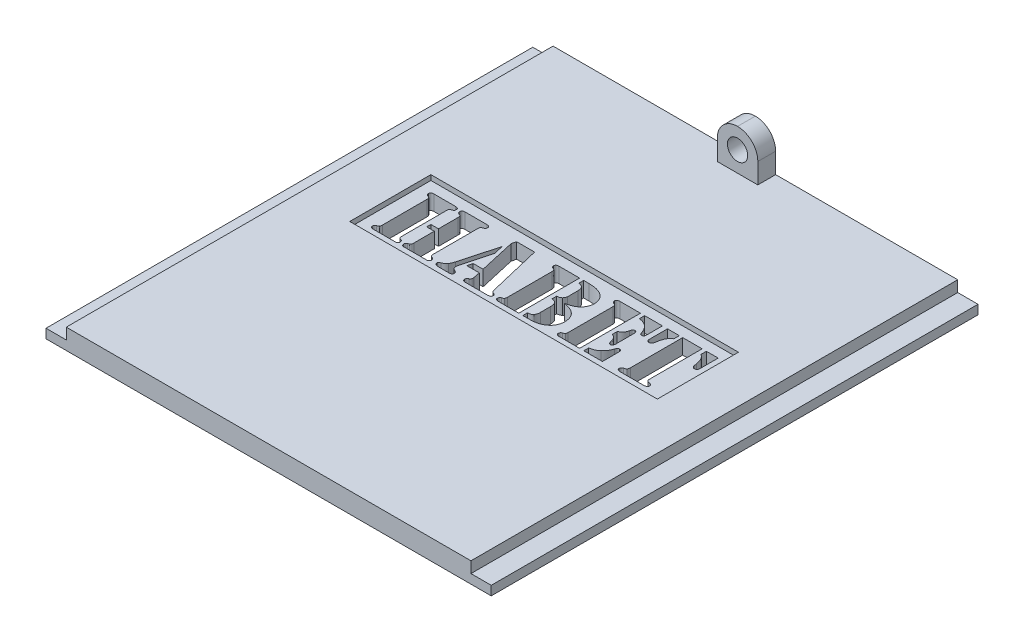
from build123d import *

# Parameters (mm, degrees)
SKETCH1_W           = 139.40028
SKETCH1_H           = 152.4
BOSS_EXTRUDE1_DEPTH = 6.35
SKETCH2_W           = 6.35
SKETCH2_H           = 152.4
CUT_EXTRUDE1_DEPTH  = 3.47472
SKETCH3_W           = 12.7
SKETCH3_H           = 5.586339271
BOSS_EXTRUDE2_DEPTH = 12.7
FILLET1_R           = 6.35
SKETCH4_R           = 3.175
CUT_EXTRUDE2_DEPTH  = 6.35
CUT_EXTRUDE7_DEPTH  = 6.35
SKETCH9_W           = 96.308333333
SKETCH9_H           = 25.4
CUT_EXTRUDE8_DEPTH  = 1.5875


with BuildPart() as part:
    # Sketch1 → Boss-Extrude1 (new body)
    with BuildSketch(Plane(origin=(0, 0, 0), x_dir=(1, 0, 0), z_dir=(0, 1, 0))):
        with Locations((69.70014, 76.2)):
            Rectangle(SKETCH1_W, SKETCH1_H)
    extrude(amount=BOSS_EXTRUDE1_DEPTH)

    # Sketch2 → Cut-Extrude1 (cut)
    with BuildSketch(Plane(origin=(0, 6.35, 0), x_dir=(1, 0, 0), z_dir=(0, 1, 0))):
        with Locations((3.175, 76.2)):
            Rectangle(SKETCH2_W, SKETCH2_H)
        with Locations((136.22528, 76.2)):
            Rectangle(SKETCH2_W, SKETCH2_H)
    extrude(amount=-CUT_EXTRUDE1_DEPTH, mode=Mode.SUBTRACT)

    # Sketch3 → Boss-Extrude2 (add)
    with BuildSketch(Plane(origin=(0, 6.35, 0), x_dir=(1, 0, 0), z_dir=(0, 1, 0))):
        with Locations((69.70014, 149.606830365)):
            Rectangle(SKETCH3_W, SKETCH3_H)
    extrude(amount=BOSS_EXTRUDE2_DEPTH)

    # Fillet1
    fillet1_edges = [part.edges().sort_by_distance(p)[0] for p in [
        (63.35014, 19.05, -149.606830364),
        (76.05014, 19.05, -149.606830364),
    ]]
    fillet(fillet1_edges, radius=FILLET1_R - 0.0001)  # a hair under: the kernel refuses the full size

    # Sketch4 → Cut-Extrude2 (cut)
    with BuildSketch(Plane(origin=(0, 0, -152.4), x_dir=(-1, 0, 0), z_dir=(0, 0, -1))):
        with Locations((-69.70014, 12.7)):
            Circle(SKETCH4_R)
    extrude(amount=-CUT_EXTRUDE2_DEPTH, mode=Mode.SUBTRACT)

    # Sketch7 → Cut-Extrude7 (cut)
    with BuildSketch(Plane(origin=(0, 6.35, 0), x_dir=(1, 0, 0), z_dir=(0, 1, 0))):
        with BuildLine():
            Line((33.98139, 86.51875), (36.36264, 86.51875))
            Line((36.36264, 86.51875), (36.36264, 92.674446615))
            add(Edge.make_bspline(
                [(36.36264, 92.674446615), (36.358254969, 92.79337412), (36.350353986, 93.007658614), (36.288467493, 93.292216987), (36.162305987, 93.506420615), (36.034402539, 93.575942696), (35.974033229, 93.60875651)],
                knots=[0, 0, 0, 0, 1.329658115, 2.395788229, 3.242826058, 4, 4, 4, 4], degree=3))
            Line((35.974033229, 93.60875651), (35.548219427, 93.749316406))
            add(Edge.make_bspline(
                [(35.548219427, 93.749316406), (35.470363369, 93.781123373), (35.321358774, 93.841997045), (35.155464255, 94.021364361), (35.054604435, 94.251060369), (35.044935177, 94.421992946), (35.039723333, 94.514127604)],
                knots=[0, 0, 0, 0, 1.010910902, 1.93472894, 2.886794743, 4, 4, 4, 4], degree=3))
            add(Edge.make_bspline(
                [(35.039723333, 94.514127604), (35.04336266, 94.57213883), (35.050224938, 94.681524219), (35.088866411, 94.836962832), (35.169501188, 94.963061381), (35.267416045, 95.076717923), (35.407472018, 95.152993869), (35.568945655, 95.211291763), (35.760655444, 95.243111258), (35.89676234, 95.247592183), (35.969899115, 95.25)],
                knots=[0, 0, 0, 0, 1.031021055, 1.944083, 2.799047815, 3.663736344, 4.573193868, 5.585804961, 6.702737011, 8, 8, 8, 8], degree=3))
            Line((35.969899115, 95.25), (36.346103542, 95.25))
            Line((36.346103542, 95.25), (42.448056667, 95.25))
            Line((42.448056667, 95.25), (42.824261094, 95.25))
            add(Edge.make_bspline(
                [(42.824261094, 95.25), (42.898791771, 95.247612679), (43.037665311, 95.243164367), (43.233215097, 95.21099988), (43.398335765, 95.154213485), (43.539059768, 95.075320206), (43.64142448, 94.964578719), (43.721620777, 94.836761147), (43.760533683, 94.681583868), (43.767355477, 94.572159502), (43.770973333, 94.514127604)],
                knots=[0, 0, 0, 0, 1.307240179, 2.435789904, 3.46013341, 4.359666904, 5.231495482, 6.077130894, 6.980229479, 8, 8, 8, 8], degree=3))
            add(Edge.make_bspline(
                [(43.770973333, 94.514127604), (43.765427394, 94.424815204), (43.754992327, 94.256767783), (43.654376024, 94.027773862), (43.485227457, 93.846294181), (43.333409962, 93.782563674), (43.25420901, 93.749316406)],
                knots=[0, 0, 0, 0, 1.076488905, 2.025487884, 2.96992611, 4, 4, 4, 4], degree=3))
            add(Edge.make_bspline(
                [(43.25420901, 93.749316406), (43.189425968, 93.725968045), (43.076248368, 93.685177873), (42.927147542, 93.630428772), (42.82429549, 93.589829846), (42.739491177, 93.55875196), (42.66735573, 93.495159348), (42.628064728, 93.433734975), (42.605153021, 93.397916667)],
                knots=[0, 0, 0, 0, 1.636602956, 2.859186374, 3.771360974, 4.270120389, 4.991257728, 6, 6, 6, 6], degree=3))
            add(Edge.make_bspline(
                [(42.605153021, 93.397916667), (42.579472533, 93.354754533), (42.525073829, 93.263324641), (42.485762356, 93.093362429), (42.448793771, 92.896571318), (42.44831364, 92.751884818), (42.448056667, 92.674446615)],
                knots=[0, 0, 0, 0, 0.798774196, 1.692034923, 2.764745377, 4, 4, 4, 4], degree=3))
            Line((42.448056667, 92.674446615), (42.448056667, 78.783821615))
            add(Edge.make_bspline(
                [(42.448056667, 78.783821615), (42.451553734, 78.668832217), (42.457937005, 78.458939622), (42.532250986, 78.178888253), (42.666620642, 77.962588408), (42.800976502, 77.889028473), (42.86560224, 77.853645833)],
                knots=[0, 0, 0, 0, 1.273136709, 2.323883542, 3.193780884, 4, 4, 4, 4], degree=3))
            Line((42.86560224, 77.853645833), (43.266611354, 77.700683594))
            add(Edge.make_bspline(
                [(43.266611354, 77.700683594), (43.342375807, 77.666632393), (43.488753114, 77.600845301), (43.66197076, 77.426532205), (43.752659696, 77.192828477), (43.764635802, 77.024793412), (43.770973333, 76.935872396)],
                knots=[0, 0, 0, 0, 1.008735212, 1.948881546, 2.914586453, 4, 4, 4, 4], degree=3))
            add(Edge.make_bspline(
                [(43.770973333, 76.935872396), (43.767383149, 76.877810317), (43.760613534, 76.768329042), (43.721350783, 76.613533324), (43.642901287, 76.485228447), (43.536300035, 76.379579608), (43.399994513, 76.294578242), (43.232911828, 76.239447166), (43.037758826, 76.206697784), (42.898824431, 76.202339178), (42.824261094, 76.2)],
                knots=[0, 0, 0, 0, 1.020367685, 1.923995112, 2.770125717, 3.62519578, 4.537840383, 5.562783731, 6.691994319, 8, 8, 8, 8], degree=3))
            Line((42.824261094, 76.2), (42.448056667, 76.2))
            Line((42.448056667, 76.2), (36.346103542, 76.2))
            Line((36.346103542, 76.2), (35.940960313, 76.2))
            add(Edge.make_bspline(
                [(35.940960313, 76.2), (35.870520425, 76.202386592), (35.738419135, 76.206862349), (35.552881903, 76.23946176), (35.39342755, 76.294319164), (35.265559402, 76.381088307), (35.162631216, 76.485218543), (35.091463164, 76.615493806), (35.043260004, 76.767155513), (35.040945409, 76.877573254), (35.039723333, 76.935872396)],
                knots=[0, 0, 0, 0, 1.272236934, 2.38592289, 3.394408416, 4.29229074, 5.155307538, 6.014002022, 6.951418688, 8, 8, 8, 8], degree=3))
            add(Edge.make_bspline(
                [(35.039723333, 76.935872396), (35.045537841, 77.025063688), (35.056560809, 77.194149861), (35.154074399, 77.423933889), (35.322342623, 77.603448603), (35.470519219, 77.667235365), (35.548219427, 77.700683594)],
                knots=[0, 0, 0, 0, 1.082756457, 2.052657179, 2.978860728, 4, 4, 4, 4], degree=3))
            Line((35.548219427, 77.700683594), (35.974033229, 77.853645833))
            add(Edge.make_bspline(
                [(35.974033229, 77.853645833), (36.034583478, 77.883362518), (36.164380885, 77.947064133), (36.287999465, 78.162629813), (36.350817717, 78.447572739), (36.358406621, 78.663416038), (36.36264, 78.783821615)],
                knots=[0, 0, 0, 0, 0.740865868, 1.588143233, 2.65457484, 4, 4, 4, 4], degree=3))
            Line((36.36264, 78.783821615), (36.36264, 85.195833333))
            Line((36.36264, 85.195833333), (33.98139, 85.195833333))
            Line((33.98139, 85.195833333), (33.98139, 86.51875))
        make_face()
        with BuildLine():
            Line((32.670875677, 76.2), (26.560654323, 76.2))
            Line((26.560654323, 76.2), (26.19685224, 76.2))
            add(Edge.make_bspline(
                [(26.19685224, 76.2), (26.125040689, 76.202376158), (25.99021491, 76.20683738), (25.799288606, 76.239878552), (25.632545952, 76.295443288), (25.493913669, 76.379738123), (25.3803164, 76.484168123), (25.308200717, 76.615713486), (25.258386897, 76.762863504), (25.25299464, 76.867876553), (25.25014, 76.923470052)],
                knots=[0, 0, 0, 0, 1.275809178, 2.395324508, 3.433364274, 4.378530456, 5.262016052, 6.140052186, 7.015350866, 8, 8, 8, 8], degree=3))
            add(Edge.make_bspline(
                [(25.25014, 76.923470052), (25.255764401, 77.011322637), (25.266343696, 77.176570169), (25.365586585, 77.402040721), (25.53902331, 77.574260052), (25.688152596, 77.638055756), (25.766904323, 77.671744792)],
                knots=[0, 0, 0, 0, 1.074896783, 2.021841926, 2.955380476, 4, 4, 4, 4], degree=3))
            add(Edge.make_bspline(
                [(25.766904323, 77.671744792), (25.831764671, 77.694901049), (25.945077324, 77.73535561), (26.091766098, 77.791349819), (26.194674971, 77.827086055), (26.278053349, 77.859200862), (26.353929924, 77.919864491), (26.393323411, 77.982828852), (26.415960313, 78.019010417)],
                knots=[0, 0, 0, 0, 1.641128884, 2.867093284, 3.73955991, 4.239698614, 4.988468111, 6, 6, 6, 6], degree=3))
            add(Edge.make_bspline(
                [(26.415960313, 78.019010417), (26.441295424, 78.060864408), (26.495870371, 78.151023056), (26.540989365, 78.315666281), (26.570686683, 78.509819854), (26.572223759, 78.649989265), (26.573056667, 78.72594401)],
                knots=[0, 0, 0, 0, 0.795728394, 1.714096871, 2.761318972, 4, 4, 4, 4], degree=3))
            Line((26.573056667, 78.72594401), (26.573056667, 92.674446615))
            add(Edge.make_bspline(
                [(26.573056667, 92.674446615), (26.572046863, 92.751741764), (26.570162914, 92.895948045), (26.542191832, 93.09462471), (26.494872664, 93.262615041), (26.441203426, 93.354635303), (26.415960313, 93.397916667)],
                knots=[0, 0, 0, 0, 1.234380862, 2.302932019, 3.201790819, 4, 4, 4, 4], degree=3))
            add(Edge.make_bspline(
                [(26.415960313, 93.397916667), (26.393311355, 93.434066441), (26.353896887, 93.496975479), (26.278134024, 93.55793895), (26.193961827, 93.589345755), (26.092981985, 93.631533479), (25.944777423, 93.684916037), (25.831655498, 93.725872729), (25.766904323, 93.749316406)],
                knots=[0, 0, 0, 0, 1.009569614, 1.75688657, 2.256055053, 3.138468602, 4.362054748, 6, 6, 6, 6], degree=3))
            add(Edge.make_bspline(
                [(25.766904323, 93.749316406), (25.687703372, 93.782563674), (25.535885877, 93.846294181), (25.366737309, 94.027773862), (25.266121006, 94.256767783), (25.255685939, 94.424815204), (25.25014, 94.514127604)],
                knots=[0, 0, 0, 0, 1.03007389, 1.974512116, 2.923511095, 4, 4, 4, 4], degree=3))
            add(Edge.make_bspline(
                [(25.25014, 94.514127604), (25.253061441, 94.571058029), (25.258584712, 94.678690563), (25.307217029, 94.829116359), (25.380433718, 94.961594207), (25.493782166, 95.066425937), (25.633401371, 95.149446212), (25.798303404, 95.211468089), (25.990370768, 95.242735765), (26.125094854, 95.2474755), (26.19685224, 95.25)],
                knots=[0, 0, 0, 0, 1.002003185, 1.894384998, 2.766311233, 3.643649008, 4.582238159, 5.621343591, 6.733068665, 8, 8, 8, 8], degree=3))
            Line((26.19685224, 95.25), (26.560654323, 95.25))
            Line((26.560654323, 95.25), (32.670875677, 95.25))
            Line((32.670875677, 95.25), (33.03467776, 95.25))
            add(Edge.make_bspline(
                [(33.03467776, 95.25), (33.109208438, 95.247612679), (33.248081978, 95.243164367), (33.443631763, 95.21099988), (33.608752432, 95.154213485), (33.749476435, 95.075320206), (33.851841147, 94.964578719), (33.932037444, 94.836761147), (33.970950349, 94.681583868), (33.977772143, 94.572159502), (33.98139, 94.514127604)],
                knots=[0, 0, 0, 0, 1.307240179, 2.435789904, 3.46013341, 4.359666904, 5.231495482, 6.077130894, 6.980229479, 8, 8, 8, 8], degree=3))
            add(Edge.make_bspline(
                [(33.98139, 94.514127604), (33.976105432, 94.42206441), (33.966301251, 94.251264417), (33.865944671, 94.019796617), (33.695643123, 93.843228467), (33.546317909, 93.781419437), (33.468759792, 93.749316406)],
                knots=[0, 0, 0, 0, 1.109983163, 2.059293279, 2.992015108, 4, 4, 4, 4], degree=3))
            Line((33.468759792, 93.749316406), (33.051214219, 93.60875651))
            add(Edge.make_bspline(
                [(33.051214219, 93.60875651), (32.98888829, 93.5764385), (32.858683699, 93.508923206), (32.738857753, 93.289917427), (32.668583654, 93.008801655), (32.662078061, 92.793657362), (32.658473333, 92.674446615)],
                knots=[0, 0, 0, 0, 0.768469074, 1.605402508, 2.673161374, 4, 4, 4, 4], degree=3))
            Line((32.658473333, 92.674446615), (32.658473333, 78.72594401))
            add(Edge.make_bspline(
                [(32.658473333, 78.72594401), (32.661883817, 78.609413714), (32.668025728, 78.399555311), (32.740580589, 78.124696759), (32.858603203, 77.907979191), (32.988862232, 77.840480592), (33.051214219, 77.808170573)],
                knots=[0, 0, 0, 0, 1.316005662, 2.369983217, 3.219748642, 4, 4, 4, 4], degree=3))
            Line((33.051214219, 77.808170573), (33.468759792, 77.671744792))
            add(Edge.make_bspline(
                [(33.468759792, 77.671744792), (33.546199843, 77.641049819), (33.694905023, 77.582107431), (33.867066383, 77.409191576), (33.964979806, 77.180475024), (33.975695118, 77.012659308), (33.98139, 76.923470052)],
                knots=[0, 0, 0, 0, 1.013906066, 1.946965185, 2.908870689, 4, 4, 4, 4], degree=3))
            add(Edge.make_bspline(
                [(33.98139, 76.923470052), (33.977716568, 76.866780426), (33.970711377, 76.758673959), (33.931592537, 76.60541922), (33.854459795, 76.477255135), (33.746284361, 76.375168893), (33.609219932, 76.29532482), (33.443486072, 76.239144002), (33.248126903, 76.206791266), (33.109224128, 76.202371826), (33.03467776, 76.2)],
                knots=[0, 0, 0, 0, 1.003012501, 1.91273332, 2.764569601, 3.608364563, 4.51449415, 5.546348955, 6.6831741, 8, 8, 8, 8], degree=3))
            Line((33.03467776, 76.2), (32.670875677, 76.2))
        make_face()
        with BuildLine():
            Line((52.097080104, 95.25), (57.719475938, 95.25))
            Line((57.719475938, 95.25), (61.626214219, 78.849967448))
            add(Edge.make_bspline(
                [(61.626214219, 78.849967448), (61.663908229, 78.714167542), (61.735791565, 78.45519403), (61.832431222, 78.204426775), (61.878395208, 78.08515625)],
                knots=[0, 0, 0, 0, 1.048755183, 2, 2, 2, 2], degree=3))
            add(Edge.make_bspline(
                [(61.878395208, 78.08515625), (61.903775603, 78.040721307), (61.956415575, 77.948561425), (62.086098711, 77.836151776), (62.247337704, 77.73267795), (62.373455726, 77.679435031), (62.440634792, 77.651074219)],
                knots=[0, 0, 0, 0, 0.840160251, 1.742526606, 2.797515595, 4, 4, 4, 4], degree=3))
            add(Edge.make_bspline(
                [(62.440634792, 77.651074219), (62.546019514, 77.60421987), (62.72678057, 77.523852987), (62.947620792, 77.365376206), (63.073527844, 77.159540795), (63.081391452, 77.007916743), (63.085556667, 76.927604167)],
                knots=[0, 0, 0, 0, 1.326867952, 2.275909135, 3.086779591, 4, 4, 4, 4], degree=3))
            add(Edge.make_bspline(
                [(63.085556667, 76.927604167), (63.083044393, 76.870610428), (63.078197883, 76.760661926), (63.022192103, 76.608108908), (62.931589388, 76.477852908), (62.803885359, 76.373596881), (62.640694722, 76.295202274), (62.445308952, 76.238324756), (62.214241495, 76.207023002), (62.049365909, 76.202449202), (61.9610775, 76.2)],
                knots=[0, 0, 0, 0, 0.899652897, 1.735550104, 2.535289427, 3.388132219, 4.315971308, 5.386976564, 6.600765056, 8, 8, 8, 8], degree=3))
            Line((61.9610775, 76.2), (54.999228542, 76.2))
            add(Edge.make_bspline(
                [(54.999228542, 76.2), (54.934178971, 76.201768506), (54.808151906, 76.205194811), (54.63154095, 76.248414359), (54.471893417, 76.310201857), (54.336293061, 76.400351231), (54.227086661, 76.513792589), (54.145592604, 76.644076493), (54.099425362, 76.793726157), (54.093028058, 76.898358033), (54.089723333, 76.952408854)],
                knots=[0, 0, 0, 0, 1.175318829, 2.277063206, 3.273429624, 4.263211015, 5.198644873, 6.106027898, 7.021610334, 8, 8, 8, 8], degree=3))
            add(Edge.make_bspline(
                [(54.089723333, 76.952408854), (54.092333304, 77.03589774), (54.096978067, 77.184476414), (54.169258916, 77.358870658), (54.267663195, 77.465599972), (54.375519239, 77.546627241), (54.509765512, 77.642792935), (54.615420346, 77.701802334), (54.67263349, 77.73375651)],
                knots=[0, 0, 0, 0, 1.432553572, 2.549404146, 3.155101411, 3.915709373, 4.871335893, 6, 6, 6, 6], degree=3))
            add(Edge.make_bspline(
                [(54.67263349, 77.73375651), (54.749784625, 77.781089926), (54.888697166, 77.866314921), (55.048779309, 78.038471568), (55.139320671, 78.245156556), (55.145018229, 78.394252163), (55.148056667, 78.473763021)],
                knots=[0, 0, 0, 0, 1.161992046, 2.092195629, 2.982591342, 4, 4, 4, 4], degree=3))
            add(Edge.make_bspline(
                [(55.148056667, 78.473763021), (55.147476783, 78.549752782), (55.146385804, 78.692718112), (55.122186422, 78.833584537), (55.110849635, 78.899576823)],
                knots=[0, 0, 0, 0, 1.063051602, 2, 2, 2, 2], degree=3))
            Line((55.110849635, 78.899576823), (54.705706406, 80.9625))
            Line((54.705706406, 80.9625), (50.815504583, 80.9625))
            Line((50.815504583, 80.9625), (51.19170901, 82.55))
            Line((51.19170901, 82.55), (54.317099635, 82.55))
            Line((54.317099635, 82.55), (51.749814479, 93.8609375))
            Line((51.749814479, 93.8609375), (52.097080104, 95.25))
        make_face()
        with BuildLine():
            Line((51.133831406, 91.653320312), (51.844899115, 88.751171875))
            Line((51.844899115, 88.751171875), (49.434710313, 79.780143229))
            add(Edge.make_bspline(
                [(49.434710313, 79.780143229), (49.404442749, 79.656718777), (49.346438878, 79.420191774), (49.333439419, 79.177065489), (49.327223333, 79.060807292)],
                knots=[0, 0, 0, 0, 1.043639418, 2, 2, 2, 2], degree=3))
            add(Edge.make_bspline(
                [(49.327223333, 79.060807292), (49.334278502, 78.924141807), (49.347750577, 78.663174622), (49.497289144, 78.306918913), (49.732700161, 78.007051937), (49.950233498, 77.87882982), (50.063095729, 77.812304687)],
                knots=[0, 0, 0, 0, 1.065909191, 2.035388236, 2.980705811, 4, 4, 4, 4], degree=3))
            Line((50.063095729, 77.812304687), (50.501311875, 77.5890625))
            add(Edge.make_bspline(
                [(50.501311875, 77.5890625), (50.564634562, 77.551119218), (50.685353588, 77.478783754), (50.822393704, 77.314781266), (50.902845564, 77.114995286), (50.910673713, 76.969696514), (50.914723333, 76.89453125)],
                knots=[0, 0, 0, 0, 1.03129857, 1.96607825, 2.947821365, 4, 4, 4, 4], degree=3))
            add(Edge.make_bspline(
                [(50.914723333, 76.89453125), (50.913414574, 76.840364794), (50.910910151, 76.736712589), (50.862304065, 76.593243141), (50.791211119, 76.470365505), (50.693387766, 76.3651821), (50.560513591, 76.293418377), (50.404283934, 76.239008435), (50.22006117, 76.20690764), (50.088025413, 76.202402343), (50.017620469, 76.2)],
                knots=[0, 0, 0, 0, 1.001089615, 1.915671698, 2.776004461, 3.626767041, 4.544209435, 5.547912865, 6.692482548, 8, 8, 8, 8], degree=3))
            Line((50.017620469, 76.2), (46.474684271, 76.2))
            add(Edge.make_bspline(
                [(46.474684271, 76.2), (46.393165819, 76.201748698), (46.237223015, 76.205093915), (46.017440351, 76.247354884), (45.82223882, 76.312594435), (45.657289001, 76.406213205), (45.52349119, 76.525301254), (45.42643889, 76.666646734), (45.371082155, 76.831477198), (45.362779988, 76.9464905), (45.358473333, 77.006152344)],
                knots=[0, 0, 0, 0, 1.263225168, 2.41651886, 3.457937625, 4.444571192, 5.337806274, 6.215550556, 7.074337118, 8, 8, 8, 8], degree=3))
            add(Edge.make_bspline(
                [(45.358473333, 77.006152344), (45.365632938, 77.072691554), (45.380469635, 77.210579343), (45.51241368, 77.394878213), (45.711854483, 77.554665749), (45.878451373, 77.632794376), (45.970322292, 77.675878906)],
                knots=[0, 0, 0, 0, 0.824400861, 1.708388363, 2.736276122, 4, 4, 4, 4], degree=3))
            add(Edge.make_bspline(
                [(45.970322292, 77.675878906), (46.060215941, 77.715116947), (46.229184636, 77.788870772), (46.460757524, 77.902778389), (46.651523513, 78.015274139), (46.864259539, 78.156330633), (47.100586801, 78.369083883), (47.25646636, 78.570211968), (47.338714219, 78.676334635)],
                knots=[0, 0, 0, 0, 1.026075952, 1.928664772, 2.697596979, 3.341335493, 4.597189607, 6, 6, 6, 6], degree=3))
            add(Edge.make_bspline(
                [(47.338714219, 78.676334635), (47.402883936, 78.778493946), (47.536952591, 78.991933588), (47.702873981, 79.351142535), (47.858697725, 79.753364872), (47.938043795, 80.042488231), (47.979501979, 80.193554687)],
                knots=[0, 0, 0, 0, 0.874304226, 1.826668352, 2.864437965, 4, 4, 4, 4], degree=3))
            Line((47.979501979, 80.193554687), (51.133831406, 91.653320312))
        make_face()
        with BuildLine():
            Line((71.816806667, 95.25), (71.816806667, 76.2))
            Line((71.816806667, 76.2), (65.718987656, 76.2))
            Line((65.718987656, 76.2), (65.355185573, 76.2))
            add(Edge.make_bspline(
                [(65.355185573, 76.2), (65.283374023, 76.202376158), (65.148548243, 76.20683738), (64.95762194, 76.239878552), (64.790879285, 76.295443288), (64.652247002, 76.379738123), (64.538649733, 76.484168123), (64.466534051, 76.615713486), (64.41672023, 76.762863504), (64.411327973, 76.867876553), (64.408473333, 76.923470052)],
                knots=[0, 0, 0, 0, 1.275809178, 2.395324508, 3.433364274, 4.378530456, 5.262016052, 6.140052186, 7.015350866, 8, 8, 8, 8], degree=3))
            add(Edge.make_bspline(
                [(64.408473333, 76.923470052), (64.414097735, 77.011322637), (64.42467703, 77.176570169), (64.523919918, 77.402040721), (64.697356644, 77.574260052), (64.84648593, 77.638055756), (64.925237656, 77.671744792)],
                knots=[0, 0, 0, 0, 1.074896783, 2.021841926, 2.955380476, 4, 4, 4, 4], degree=3))
            add(Edge.make_bspline(
                [(64.925237656, 77.671744792), (64.990098004, 77.694901049), (65.103410658, 77.73535561), (65.250099431, 77.791349819), (65.353008305, 77.827086055), (65.436386683, 77.859200862), (65.512263257, 77.919864491), (65.551656744, 77.982828852), (65.574293646, 78.019010417)],
                knots=[0, 0, 0, 0, 1.641128884, 2.867093284, 3.73955991, 4.239698614, 4.988468111, 6, 6, 6, 6], degree=3))
            add(Edge.make_bspline(
                [(65.574293646, 78.019010417), (65.599628757, 78.060864408), (65.654203704, 78.151023056), (65.699322698, 78.315666281), (65.729020017, 78.509819854), (65.730557092, 78.649989265), (65.73139, 78.72594401)],
                knots=[0, 0, 0, 0, 0.795728394, 1.714096871, 2.761318972, 4, 4, 4, 4], degree=3))
            Line((65.73139, 78.72594401), (65.73139, 92.674446615))
            add(Edge.make_bspline(
                [(65.73139, 92.674446615), (65.730380196, 92.751741764), (65.728496247, 92.895948045), (65.700525166, 93.09462471), (65.653205998, 93.262615041), (65.599536759, 93.354635303), (65.574293646, 93.397916667)],
                knots=[0, 0, 0, 0, 1.234380862, 2.302932019, 3.201790819, 4, 4, 4, 4], degree=3))
            add(Edge.make_bspline(
                [(65.574293646, 93.397916667), (65.551644688, 93.434066441), (65.512230221, 93.496975479), (65.436467358, 93.55793895), (65.35229516, 93.589345755), (65.251315318, 93.631533479), (65.103110757, 93.684916037), (64.989988831, 93.725872729), (64.925237656, 93.749316406)],
                knots=[0, 0, 0, 0, 1.009569614, 1.75688657, 2.256055053, 3.138468602, 4.362054748, 6, 6, 6, 6], degree=3))
            add(Edge.make_bspline(
                [(64.925237656, 93.749316406), (64.846036705, 93.782563674), (64.69421921, 93.846294181), (64.525070643, 94.027773862), (64.424454339, 94.256767783), (64.414019273, 94.424815204), (64.408473333, 94.514127604)],
                knots=[0, 0, 0, 0, 1.03007389, 1.974512116, 2.923511095, 4, 4, 4, 4], degree=3))
            add(Edge.make_bspline(
                [(64.408473333, 94.514127604), (64.411394775, 94.571058029), (64.416918045, 94.678690563), (64.465550362, 94.829116359), (64.538767051, 94.961594207), (64.652115499, 95.066425937), (64.791734704, 95.149446212), (64.956636737, 95.211468089), (65.148704101, 95.242735765), (65.283428187, 95.2474755), (65.355185573, 95.25)],
                knots=[0, 0, 0, 0, 1.002003185, 1.894384998, 2.766311233, 3.643649008, 4.582238159, 5.621343591, 6.733068665, 8, 8, 8, 8], degree=3))
            Line((65.355185573, 95.25), (65.718987656, 95.25))
            Line((65.718987656, 95.25), (71.816806667, 95.25))
        make_face()
        with BuildLine():
            add(Edge.make_bspline(
                [(76.281650417, 86.014388021), (76.478840916, 85.973691726), (76.849208839, 85.897254968), (77.368896462, 85.779986424), (77.813759769, 85.655927045), (78.304961766, 85.498926129), (78.849044115, 85.284018209), (79.234934634, 85.047078267), (79.4235775, 84.93125)],
                knots=[0, 0, 0, 0, 1.083455462, 2.034972021, 2.866135129, 3.567292239, 4.810769005, 6, 6, 6, 6], degree=3))
            add(Edge.make_bspline(
                [(79.4235775, 84.93125), (79.572639243, 84.827566522), (79.867499636, 84.622469287), (80.255212908, 84.249710742), (80.585392286, 83.827269243), (80.855667388, 83.357932162), (81.078101722, 82.854721736), (81.226915086, 82.316775349), (81.328808281, 81.753222551), (81.337410142, 81.366741365), (81.341806667, 81.169205729)],
                knots=[0, 0, 0, 0, 0.986962337, 1.952319205, 2.913940247, 3.895330921, 4.892864158, 5.89929397, 6.926301415, 8, 8, 8, 8], degree=3))
            add(Edge.make_bspline(
                [(81.341806667, 81.169205729), (81.335874739, 80.976013916), (81.324341144, 80.600386192), (81.245419652, 80.052355628), (81.110317481, 79.536610943), (80.91286287, 79.055553817), (80.669584652, 78.602629484), (80.362028387, 78.188372275), (80.008538741, 77.799140165), (79.732698478, 77.577318637), (79.593076198, 77.465039062)],
                knots=[0, 0, 0, 0, 1.089371359, 2.118092263, 3.115302193, 4.087984299, 5.044386056, 6.006580044, 6.990989071, 8, 8, 8, 8], degree=3))
            add(Edge.make_bspline(
                [(79.593076198, 77.465039062), (79.441047279, 77.354003712), (79.138956806, 77.133369887), (78.645663877, 76.865959611), (78.132108768, 76.646282421), (77.585889358, 76.471531415), (76.985383601, 76.350047773), (76.31295452, 76.259821661), (75.556250222, 76.207495878), (75.023584027, 76.202581604), (74.743759792, 76.2)],
                knots=[0, 0, 0, 0, 0.883012022, 1.754597232, 2.627046443, 3.502775865, 4.441750639, 5.499460937, 6.686397901, 8, 8, 8, 8], degree=3))
            Line((74.743759792, 76.2), (73.081845729, 76.2))
            Line((73.081845729, 76.2), (73.081845729, 77.667610677))
            add(Edge.make_bspline(
                [(73.081845729, 77.667610677), (73.170215368, 77.674481121), (73.337916393, 77.687519315), (73.571699745, 77.727195563), (73.777443806, 77.765382097), (74.011722197, 77.837195971), (74.279274479, 77.974402899), (74.447234826, 78.140818883), (74.532919948, 78.225716146)],
                knots=[0, 0, 0, 0, 0.997306068, 1.892609856, 2.668508782, 3.350634199, 4.648423657, 6, 6, 6, 6], degree=3))
            add(Edge.make_bspline(
                [(74.532919948, 78.225716146), (74.605854051, 78.320517532), (74.759336565, 78.520017552), (74.889075163, 78.901386305), (74.979411386, 79.341630385), (74.987486486, 79.659625259), (74.991806667, 79.829752604)],
                knots=[0, 0, 0, 0, 0.837912566, 1.76330307, 2.803366532, 4, 4, 4, 4], degree=3))
            Line((74.991806667, 79.829752604), (74.991806667, 82.963411458))
            add(Edge.make_bspline(
                [(74.991806667, 82.963411458), (74.989920245, 83.072301518), (74.986334776, 83.279265741), (74.968068927, 83.56944867), (74.931294449, 83.822832007), (74.861155711, 84.107472648), (74.722093396, 84.438105106), (74.534248838, 84.646514429), (74.437835313, 84.753483073)],
                knots=[0, 0, 0, 0, 1.01571249, 1.930535679, 2.71034331, 3.399269007, 4.665142888, 6, 6, 6, 6], degree=3))
            add(Edge.make_bspline(
                [(74.437835313, 84.753483073), (74.359907295, 84.829609551), (74.208827981, 84.977196214), (73.915700236, 85.127830957), (73.55914543, 85.234768064), (73.292193952, 85.273137306), (73.139723333, 85.295052083)],
                knots=[0, 0, 0, 0, 0.904188909, 1.752954129, 2.716588957, 4, 4, 4, 4], degree=3))
            Line((73.139723333, 85.295052083), (73.139723333, 86.737858073))
            add(Edge.make_bspline(
                [(73.139723333, 86.737858073), (73.291706292, 86.752308872), (73.559500905, 86.77777124), (73.922828212, 86.857187916), (74.21628901, 86.997650878), (74.374213644, 87.129713499), (74.454371771, 87.196744792)],
                knots=[0, 0, 0, 0, 1.287514427, 2.268605844, 3.12119275, 4, 4, 4, 4], degree=3))
            add(Edge.make_bspline(
                [(74.454371771, 87.196744792), (74.52526596, 87.274237889), (74.673522786, 87.436294618), (74.832087179, 87.731936014), (74.956331797, 88.036774983), (74.980631355, 88.248607402), (74.991806667, 88.346028646)],
                knots=[0, 0, 0, 0, 0.970759611, 2.030092153, 3.0940439, 4, 4, 4, 4], degree=3))
            Line((74.991806667, 88.346028646), (74.991806667, 89.110839844))
            Line((74.991806667, 89.110839844), (74.991806667, 91.595442708))
            add(Edge.make_bspline(
                [(74.991806667, 91.595442708), (74.985026886, 91.724273986), (74.971006393, 91.99069529), (74.868524816, 92.37648405), (74.7519606, 92.740008769), (74.61828646, 92.942413827), (74.557724635, 93.034114583)],
                knots=[0, 0, 0, 0, 1.013786551, 2.096496594, 3.137607017, 4, 4, 4, 4], degree=3))
            add(Edge.make_bspline(
                [(74.557724635, 93.034114583), (74.468083274, 93.130992506), (74.295328802, 93.31769309), (74.022476146, 93.487889106), (73.782512852, 93.581789381), (73.573974052, 93.637155092), (73.338696589, 93.689316001), (73.170319818, 93.706968127), (73.081845729, 93.71624349)],
                knots=[0, 0, 0, 0, 1.414668104, 2.726311148, 3.411527514, 4.180983567, 5.044192262, 6, 6, 6, 6], degree=3))
            Line((73.081845729, 93.71624349), (73.081845729, 95.25))
            Line((73.081845729, 95.25), (74.685882188, 95.25))
            add(Edge.make_bspline(
                [(74.685882188, 95.25), (74.942332652, 95.246314056), (75.439491228, 95.239168432), (76.161710672, 95.176113185), (76.83613003, 95.074792576), (77.464078067, 94.930789095), (78.044483574, 94.744140427), (78.582028472, 94.522092075), (79.073710797, 94.255746964), (79.366629533, 94.038058728), (79.510393906, 93.931217448)],
                knots=[0, 0, 0, 0, 1.208139577, 2.342116839, 3.412856412, 4.419296771, 5.374125253, 6.282151548, 7.156880815, 8, 8, 8, 8], degree=3))
            add(Edge.make_bspline(
                [(79.510393906, 93.931217448), (79.63310187, 93.828067387), (79.874746233, 93.624937695), (80.186427223, 93.270424721), (80.45802493, 92.889424605), (80.680115548, 92.474429803), (80.857130541, 92.037771895), (80.98864178, 91.58113807), (81.062715908, 91.105934653), (81.0723635, 90.782644397), (81.077223333, 90.619791667)],
                knots=[0, 0, 0, 0, 1.013187354, 1.995233284, 2.977588935, 3.968692565, 4.966259194, 5.954519567, 6.969619199, 8, 8, 8, 8], degree=3))
            add(Edge.make_bspline(
                [(81.077223333, 90.619791667), (81.072922625, 90.458214379), (81.064379258, 90.137240657), (80.981375582, 89.663457727), (80.854381557, 89.202917774), (80.675687799, 88.76122426), (80.455824124, 88.344441626), (80.186367119, 87.965126187), (79.881692112, 87.617318704), (79.645448389, 87.41983916), (79.526930365, 87.320768229)],
                knots=[0, 0, 0, 0, 1.027420393, 2.040973403, 3.051676841, 4.062988861, 5.067394782, 6.043057479, 7.018247088, 8, 8, 8, 8], degree=3))
            add(Edge.make_bspline(
                [(79.526930365, 87.320768229), (79.337016939, 87.177384044), (78.949898476, 86.885110525), (78.38229446, 86.621071447), (77.868111414, 86.438067079), (77.404893557, 86.293684924), (76.868097978, 86.150437642), (76.484507531, 86.061448723), (76.281650417, 86.014388021)],
                knots=[0, 0, 0, 0, 1.210113677, 2.466688938, 3.168799978, 3.992996522, 4.938620763, 6, 6, 6, 6], degree=3))
        make_face()
        with BuildLine():
            Line((90.866806667, 95.25), (90.866806667, 76.2))
            Line((90.866806667, 76.2), (84.768987656, 76.2))
            Line((84.768987656, 76.2), (84.405185573, 76.2))
            add(Edge.make_bspline(
                [(84.405185573, 76.2), (84.333374023, 76.202376158), (84.198548243, 76.20683738), (84.00762194, 76.239878552), (83.840879285, 76.295443288), (83.702247002, 76.379738123), (83.588649733, 76.484168123), (83.516534051, 76.615713486), (83.46672023, 76.762863504), (83.461327973, 76.867876553), (83.458473333, 76.923470052)],
                knots=[0, 0, 0, 0, 1.275809178, 2.395324508, 3.433364274, 4.378530456, 5.262016052, 6.140052186, 7.015350866, 8, 8, 8, 8], degree=3))
            add(Edge.make_bspline(
                [(83.458473333, 76.923470052), (83.464097735, 77.011322637), (83.47467703, 77.176570169), (83.573919918, 77.402040721), (83.747356644, 77.574260052), (83.89648593, 77.638055756), (83.975237656, 77.671744792)],
                knots=[0, 0, 0, 0, 1.074896783, 2.021841926, 2.955380476, 4, 4, 4, 4], degree=3))
            add(Edge.make_bspline(
                [(83.975237656, 77.671744792), (84.040098004, 77.694901049), (84.153410658, 77.73535561), (84.300099431, 77.791349819), (84.403008305, 77.827086055), (84.486386683, 77.859200862), (84.562263257, 77.919864491), (84.601656744, 77.982828852), (84.624293646, 78.019010417)],
                knots=[0, 0, 0, 0, 1.641128884, 2.867093284, 3.73955991, 4.239698614, 4.988468111, 6, 6, 6, 6], degree=3))
            add(Edge.make_bspline(
                [(84.624293646, 78.019010417), (84.649628757, 78.060864408), (84.704203704, 78.151023056), (84.749322698, 78.315666281), (84.779020017, 78.509819854), (84.780557092, 78.649989265), (84.78139, 78.72594401)],
                knots=[0, 0, 0, 0, 0.795728394, 1.714096871, 2.761318972, 4, 4, 4, 4], degree=3))
            Line((84.78139, 78.72594401), (84.78139, 92.674446615))
            add(Edge.make_bspline(
                [(84.78139, 92.674446615), (84.780380196, 92.751741764), (84.778496247, 92.895948045), (84.750525166, 93.09462471), (84.703205998, 93.262615041), (84.649536759, 93.354635303), (84.624293646, 93.397916667)],
                knots=[0, 0, 0, 0, 1.234380862, 2.302932019, 3.201790819, 4, 4, 4, 4], degree=3))
            add(Edge.make_bspline(
                [(84.624293646, 93.397916667), (84.601644688, 93.434066441), (84.562230221, 93.496975479), (84.486467358, 93.55793895), (84.40229516, 93.589345755), (84.301315318, 93.631533479), (84.153110757, 93.684916037), (84.039988831, 93.725872729), (83.975237656, 93.749316406)],
                knots=[0, 0, 0, 0, 1.009569614, 1.75688657, 2.256055053, 3.138468602, 4.362054748, 6, 6, 6, 6], degree=3))
            add(Edge.make_bspline(
                [(83.975237656, 93.749316406), (83.896036705, 93.782563674), (83.74421921, 93.846294181), (83.575070643, 94.027773862), (83.474454339, 94.256767783), (83.464019273, 94.424815204), (83.458473333, 94.514127604)],
                knots=[0, 0, 0, 0, 1.03007389, 1.974512116, 2.923511095, 4, 4, 4, 4], degree=3))
            add(Edge.make_bspline(
                [(83.458473333, 94.514127604), (83.461394775, 94.571058029), (83.466918045, 94.678690563), (83.515550362, 94.829116359), (83.588767051, 94.961594207), (83.702115499, 95.066425937), (83.841734704, 95.149446212), (84.006636737, 95.211468089), (84.198704101, 95.242735765), (84.333428187, 95.2474755), (84.405185573, 95.25)],
                knots=[0, 0, 0, 0, 1.002003185, 1.894384998, 2.766311233, 3.643649008, 4.582238159, 5.621343591, 6.733068665, 8, 8, 8, 8], degree=3))
            Line((84.405185573, 95.25), (84.768987656, 95.25))
            Line((84.768987656, 95.25), (90.866806667, 95.25))
        make_face()
        with BuildLine():
            Line((92.189723333, 95.25), (97.745973333, 95.25))
            Line((97.745973333, 95.25), (97.745973333, 90.23531901))
            add(Edge.make_bspline(
                [(97.745973333, 90.23531901), (97.745701843, 90.168906164), (97.745199829, 90.046102181), (97.708664377, 89.87730554), (97.663331491, 89.732677828), (97.586737068, 89.617606835), (97.486951467, 89.529868618), (97.362955485, 89.473926561), (97.217861162, 89.434125699), (97.112407772, 89.430903301), (97.055576198, 89.429166667)],
                knots=[0, 0, 0, 0, 1.297100046, 2.398467488, 3.37194797, 4.248080405, 5.071011418, 5.940462097, 6.890061477, 8, 8, 8, 8], degree=3))
            add(Edge.make_bspline(
                [(97.055576198, 89.429166667), (96.968415897, 89.4345285), (96.813738727, 89.444043764), (96.627896524, 89.521378384), (96.541062394, 89.641895965), (96.473108477, 89.75571071), (96.409314475, 89.903432199), (96.372510317, 90.014523679), (96.352776719, 90.074088542)],
                knots=[0, 0, 0, 0, 1.496408907, 2.655570162, 3.259085196, 3.998612629, 4.926899124, 6, 6, 6, 6], degree=3))
            add(Edge.make_bspline(
                [(96.352776719, 90.074088542), (96.261154034, 90.332958843), (96.085338735, 90.829706558), (95.730870599, 91.508944449), (95.312559023, 92.089571565), (94.827760082, 92.576568776), (94.275122559, 92.971204926), (93.645962548, 93.269707628), (92.945779483, 93.488393445), (92.447530812, 93.556816232), (92.189723333, 93.592220052)],
                knots=[0, 0, 0, 0, 1.130832012, 2.169960077, 3.145894403, 4.069657363, 4.990096479, 5.930045021, 6.928948727, 8, 8, 8, 8], degree=3))
            Line((92.189723333, 93.592220052), (92.189723333, 95.25))
        make_face()
        with BuildLine():
            Line((92.189723333, 85.042871094), (92.189723333, 86.651041667))
            add(Edge.make_bspline(
                [(92.189723333, 86.651041667), (92.311703643, 86.717207811), (92.54487037, 86.843685135), (92.866584649, 87.045492413), (93.12891154, 87.269516892), (93.353228309, 87.499037624), (93.530134581, 87.763287135), (93.683538439, 88.056237572), (93.807131836, 88.390271784), (93.866369857, 88.627866941), (93.897112656, 88.751171875)],
                knots=[0, 0, 0, 0, 1.180986571, 2.257469038, 3.222785507, 4.110265038, 4.978639913, 5.917385587, 6.919184056, 8, 8, 8, 8], degree=3))
            add(Edge.make_bspline(
                [(93.897112656, 88.751171875), (93.914812843, 88.834273883), (93.94732151, 88.986901402), (94.014791743, 89.192798251), (94.085200824, 89.359023459), (94.171513915, 89.487976736), (94.274279381, 89.581569131), (94.392117343, 89.650145913), (94.530185053, 89.687596155), (94.62725112, 89.691624673), (94.678460313, 89.69375)],
                knots=[0, 0, 0, 0, 1.505392146, 2.764846178, 3.836585285, 4.697326174, 5.492824879, 6.280783141, 7.092991927, 8, 8, 8, 8], degree=3))
            add(Edge.make_bspline(
                [(94.678460313, 89.69375), (94.745415609, 89.691112545), (94.872670747, 89.686099801), (95.044257569, 89.612098577), (95.182367696, 89.493624), (95.239696784, 89.388819479), (95.269638698, 89.334082031)],
                knots=[0, 0, 0, 0, 1.085852217, 2.06376913, 2.988742716, 4, 4, 4, 4], degree=3))
            add(Edge.make_bspline(
                [(95.269638698, 89.334082031), (95.284838784, 89.293100452), (95.321454274, 89.194379914), (95.342449728, 89.009172338), (95.366299888, 88.768366737), (95.365286913, 88.587317413), (95.364723333, 88.486588542)],
                knots=[0, 0, 0, 0, 0.609895254, 1.469176849, 2.591947466, 4, 4, 4, 4], degree=3))
            Line((95.364723333, 88.486588542), (95.364723333, 83.19905599))
            add(Edge.make_bspline(
                [(95.364723333, 83.19905599), (95.363267061, 83.097056545), (95.360585416, 82.909230207), (95.338708115, 82.651207455), (95.294948993, 82.444034415), (95.234980289, 82.280438533), (95.143449485, 82.16138413), (95.023964683, 82.078306788), (94.875092808, 82.028475869), (94.76568713, 82.023489773), (94.707399115, 82.020833333)],
                knots=[0, 0, 0, 0, 1.58411055, 2.917051989, 4.012593196, 4.866950163, 5.598911493, 6.305405458, 7.097171608, 8, 8, 8, 8], degree=3))
            add(Edge.make_bspline(
                [(94.707399115, 82.020833333), (94.612731806, 82.029032426), (94.432036193, 82.044682392), (94.235816106, 82.179738565), (94.12958357, 82.336041811), (94.056784302, 82.485734466), (93.989301085, 82.666854755), (93.956282597, 82.800368386), (93.938453802, 82.872460937)],
                knots=[0, 0, 0, 0, 1.342036637, 2.56160375, 3.240040044, 4.033620071, 4.938225671, 6, 6, 6, 6], degree=3))
            add(Edge.make_bspline(
                [(93.938453802, 82.872460937), (93.900395712, 83.025061382), (93.827684337, 83.316610118), (93.67262018, 83.716777894), (93.502571842, 84.066505803), (93.29641801, 84.356231619), (93.064868403, 84.597076487), (92.805760778, 84.795294193), (92.511288427, 84.946844349), (92.298456594, 85.010400837), (92.189723333, 85.042871094)],
                knots=[0, 0, 0, 0, 1.278531199, 2.442680666, 3.485773606, 4.434753066, 5.322955403, 6.195374153, 7.078038041, 8, 8, 8, 8], degree=3))
        make_face()
        with BuildLine():
            Line((92.189723333, 76.2), (92.189723333, 77.737890625))
            add(Edge.make_bspline(
                [(92.189723333, 77.737890625), (92.334635652, 77.762842192), (92.613301603, 77.810823981), (93.010499456, 77.899453054), (93.367161875, 78.008799612), (93.695172566, 78.127146123), (93.997953865, 78.282926775), (94.299277977, 78.461334934), (94.598529132, 78.675378673), (94.791160898, 78.837600802), (94.889300156, 78.920247396)],
                knots=[0, 0, 0, 0, 1.178424117, 2.266106011, 3.258322885, 4.167001624, 5.056005255, 5.982165939, 6.971982955, 8, 8, 8, 8], degree=3))
            add(Edge.make_bspline(
                [(94.889300156, 78.920247396), (95.075510524, 79.094023802), (95.431025332, 79.42579956), (95.795594263, 79.911128677), (96.035584871, 80.324905947), (96.204352335, 80.677444299), (96.374122753, 81.070891082), (96.474331933, 81.353214534), (96.526409531, 81.499934896)],
                knots=[0, 0, 0, 0, 1.478913818, 2.823557948, 3.509390326, 4.258413643, 5.094916917, 6, 6, 6, 6], degree=3))
            add(Edge.make_bspline(
                [(96.526409531, 81.499934896), (96.551733141, 81.570529026), (96.598506022, 81.70091687), (96.675401328, 81.87690719), (96.757744903, 82.014323999), (96.867405142, 82.152075825), (97.054890036, 82.266462105), (97.223291483, 82.278882182), (97.311891302, 82.285416667)],
                knots=[0, 0, 0, 0, 1.119865357, 2.068399023, 2.86239926, 3.505232302, 4.687446157, 6, 6, 6, 6], degree=3))
            add(Edge.make_bspline(
                [(97.311891302, 82.285416667), (97.372671214, 82.281813733), (97.486177882, 82.275085243), (97.6444768, 82.23733429), (97.770189594, 82.159088828), (97.867458017, 82.048883345), (97.93140265, 81.899851582), (97.980926721, 81.715030784), (98.007476216, 81.486878205), (98.009476783, 81.32084197), (98.010556667, 81.231217448)],
                knots=[0, 0, 0, 0, 0.999578033, 1.866714988, 2.638932701, 3.392362113, 4.242509345, 5.27434009, 6.528718957, 8, 8, 8, 8], degree=3))
            Line((98.010556667, 81.231217448), (98.010556667, 76.2))
            Line((98.010556667, 76.2), (92.189723333, 76.2))
        make_face()
        with BuildLine():
            Line((110.18139, 95.25), (110.18139, 78.837565104))
            add(Edge.make_bspline(
                [(110.18139, 78.837565104), (110.182110783, 78.753031647), (110.183447301, 78.596284708), (110.234797248, 78.382891282), (110.291810031, 78.197136847), (110.368522107, 78.104131328), (110.404632188, 78.060351563)],
                knots=[0, 0, 0, 0, 1.221894812, 2.265709648, 3.183630964, 4, 4, 4, 4], degree=3))
            add(Edge.make_bspline(
                [(110.404632188, 78.060351563), (110.44128243, 78.020978726), (110.506215301, 77.95122226), (110.614562595, 77.886904042), (110.730515782, 77.855909465), (110.875609062, 77.826496755), (111.075985984, 77.767750826), (111.231206222, 77.732729762), (111.31827151, 77.713085938)],
                knots=[0, 0, 0, 0, 0.967781164, 1.714608312, 2.234126727, 3.127399629, 4.388716669, 6, 6, 6, 6], degree=3))
            add(Edge.make_bspline(
                [(111.31827151, 77.713085938), (111.425899158, 77.685649012), (111.623928569, 77.635166461), (111.863450211, 77.462256347), (112.011357507, 77.223242118), (112.025878197, 77.042705518), (112.033473333, 76.94827474)],
                knots=[0, 0, 0, 0, 1.155259645, 2.125619132, 3.019593567, 4, 4, 4, 4], degree=3))
            add(Edge.make_bspline(
                [(112.033473333, 76.94827474), (112.028315433, 76.891135365), (112.017975656, 76.776591005), (111.944454281, 76.612402469), (111.813087329, 76.473979599), (111.703113435, 76.402972812), (111.644866563, 76.365364583)],
                knots=[0, 0, 0, 0, 0.931770353, 1.867872026, 2.870733925, 4, 4, 4, 4], degree=3))
            add(Edge.make_bspline(
                [(111.644866563, 76.365364583), (111.590381655, 76.340212998), (111.468703127, 76.284043171), (111.25047213, 76.233543918), (110.98405455, 76.208108061), (110.79054942, 76.202848464), (110.685751979, 76.2)],
                knots=[0, 0, 0, 0, 0.731990245, 1.634718689, 2.719023992, 4, 4, 4, 4], degree=3))
            Line((110.685751979, 76.2), (110.193792344, 76.2))
            Line((110.193792344, 76.2), (104.08357099, 76.2))
            Line((104.08357099, 76.2), (103.657757188, 76.2))
            add(Edge.make_bspline(
                [(103.657757188, 76.2), (103.569465679, 76.202495361), (103.403220362, 76.20719391), (103.169533219, 76.238493785), (102.968015952, 76.295349228), (102.799433889, 76.376983788), (102.666053762, 76.484867246), (102.577032682, 76.621754931), (102.514526406, 76.776315654), (102.510533839, 76.889738742), (102.508473333, 76.94827474)],
                knots=[0, 0, 0, 0, 1.366783488, 2.573535778, 3.640164188, 4.59418564, 5.457298291, 6.256059838, 7.099977962, 8, 8, 8, 8], degree=3))
            add(Edge.make_bspline(
                [(102.508473333, 76.94827474), (102.513389638, 77.042541963), (102.522699609, 77.221055139), (102.655329005, 77.453784496), (102.857847884, 77.634349361), (103.034048668, 77.685591554), (103.128590521, 77.713085938)],
                knots=[0, 0, 0, 0, 1.041821617, 1.972890251, 2.912339053, 4, 4, 4, 4], degree=3))
            add(Edge.make_bspline(
                [(103.128590521, 77.713085938), (103.204686487, 77.732688443), (103.339468638, 77.767408652), (103.510694332, 77.825520041), (103.633699769, 77.856349077), (103.732287948, 77.887446115), (103.824297001, 77.951648967), (103.873682176, 78.021031056), (103.901669948, 78.060351563)],
                knots=[0, 0, 0, 0, 1.624637859, 2.877579422, 3.734891967, 4.248647568, 5.007466236, 6, 6, 6, 6], degree=3))
            add(Edge.make_bspline(
                [(103.901669948, 78.060351563), (103.933296023, 78.104493213), (104.001485468, 78.199667677), (104.051055586, 78.383305321), (104.091370446, 78.597294792), (104.094357128, 78.75319932), (104.095973333, 78.837565104)],
                knots=[0, 0, 0, 0, 0.793417505, 1.710699182, 2.761173524, 4, 4, 4, 4], degree=3))
            Line((104.095973333, 78.837565104), (104.095973333, 95.25))
            Line((104.095973333, 95.25), (110.18139, 95.25))
        make_face()
        with BuildLine():
            Line((115.208473333, 95.25), (115.208473333, 89.503580729))
            add(Edge.make_bspline(
                [(115.208473333, 89.503580729), (115.207229313, 89.44114662), (115.204840986, 89.321282768), (115.154703548, 89.153123104), (115.086952154, 88.999325351), (114.980945179, 88.872540241), (114.856927019, 88.767504035), (114.711925739, 88.690995065), (114.549710477, 88.645464442), (114.435681088, 88.638810665), (114.377516302, 88.635416667)],
                knots=[0, 0, 0, 0, 1.105202659, 2.121818522, 3.097439387, 4.073367971, 5.030344682, 5.973096339, 6.966104969, 8, 8, 8, 8], degree=3))
            add(Edge.make_bspline(
                [(114.377516302, 88.635416667), (114.320583674, 88.636757865), (114.210193254, 88.639358403), (114.054372223, 88.689722184), (113.91075196, 88.758576675), (113.741745166, 88.895964506), (113.573859591, 89.14132005), (113.518225062, 89.372532578), (113.488681667, 89.4953125)],
                knots=[0, 0, 0, 0, 0.752729949, 1.459517639, 2.155550537, 2.859009912, 4.332051802, 6, 6, 6, 6], degree=3))
            Line((113.488681667, 89.4953125), (113.348121771, 90.34280599))
            add(Edge.make_bspline(
                [(113.348121771, 90.34280599), (113.309980321, 90.552007697), (113.235291747, 90.961666414), (113.048390508, 91.544018839), (112.826301673, 92.088265307), (112.630153865, 92.417477129), (112.533701198, 92.579361979)],
                knots=[0, 0, 0, 0, 1.063876179, 2.083281991, 3.057483401, 4, 4, 4, 4], degree=3))
            add(Edge.make_bspline(
                [(112.533701198, 92.579361979), (112.46674079, 92.673187232), (112.331778965, 92.862296403), (112.092147195, 93.120426767), (111.810615087, 93.343157679), (111.607455521, 93.472703251), (111.504306667, 93.538476562)],
                knots=[0, 0, 0, 0, 0.974063882, 1.963271173, 2.965905228, 4, 4, 4, 4], degree=3))
            Line((111.504306667, 93.538476562), (111.504306667, 95.25))
            Line((111.504306667, 95.25), (115.208473333, 95.25))
        make_face()
        with BuildLine():
            Line((99.333473333, 95.25), (103.03764, 95.25))
            Line((103.03764, 95.25), (103.03764, 93.538476562))
            add(Edge.make_bspline(
                [(103.03764, 93.538476562), (102.931246066, 93.473374127), (102.724518437, 93.346877516), (102.445836958, 93.118579649), (102.205668812, 92.86367798), (102.073556524, 92.673418628), (102.008245469, 92.579361979)],
                knots=[0, 0, 0, 0, 1.052671273, 2.045381983, 3.033714676, 4, 4, 4, 4], degree=3))
            add(Edge.make_bspline(
                [(102.008245469, 92.579361979), (101.911792801, 92.417477129), (101.715644993, 92.088265307), (101.493556158, 91.544018839), (101.30665492, 90.961666414), (101.231966345, 90.552007697), (101.193824896, 90.34280599)],
                knots=[0, 0, 0, 0, 0.942516599, 1.916718009, 2.936123821, 4, 4, 4, 4], degree=3))
            Line((101.193824896, 90.34280599), (101.053265, 89.4953125))
            add(Edge.make_bspline(
                [(101.053265, 89.4953125), (101.024080838, 89.372300326), (100.968938278, 89.139872677), (100.796380186, 88.896476749), (100.627838403, 88.759833184), (100.486712587, 88.688683551), (100.331666351, 88.639538051), (100.22133337, 88.636818991), (100.164430365, 88.635416667)],
                knots=[0, 0, 0, 0, 1.669557139, 3.154575889, 3.858713837, 4.539074476, 5.246543951, 6, 6, 6, 6], degree=3))
            add(Edge.make_bspline(
                [(100.164430365, 88.635416667), (100.106274828, 88.638816947), (99.992263572, 88.645483041), (99.829918625, 88.69092558), (99.685384436, 88.767751802), (99.560267118, 88.871041404), (99.460926393, 89.001990317), (99.384481758, 89.151049934), (99.344051577, 89.322417275), (99.337105165, 89.44138183), (99.333473333, 89.503580729)],
                knots=[0, 0, 0, 0, 1.035033885, 2.029136333, 2.972926449, 3.930957286, 4.89275004, 5.880170392, 6.891677706, 8, 8, 8, 8], degree=3))
            Line((99.333473333, 89.503580729), (99.333473333, 95.25))
        make_face()
    extrude(amount=-CUT_EXTRUDE7_DEPTH, mode=Mode.SUBTRACT)

    # Sketch9 → Cut-Extrude8 (cut)
    with BuildSketch(Plane(origin=(0, 6.35, 0), x_dir=(1, 0, 0), z_dir=(0, 1, 0))):
        with Locations((70.229306667, 85.725)):
            Rectangle(SKETCH9_W, SKETCH9_H)
    extrude(amount=-CUT_EXTRUDE8_DEPTH, mode=Mode.SUBTRACT)


solid = part.part
